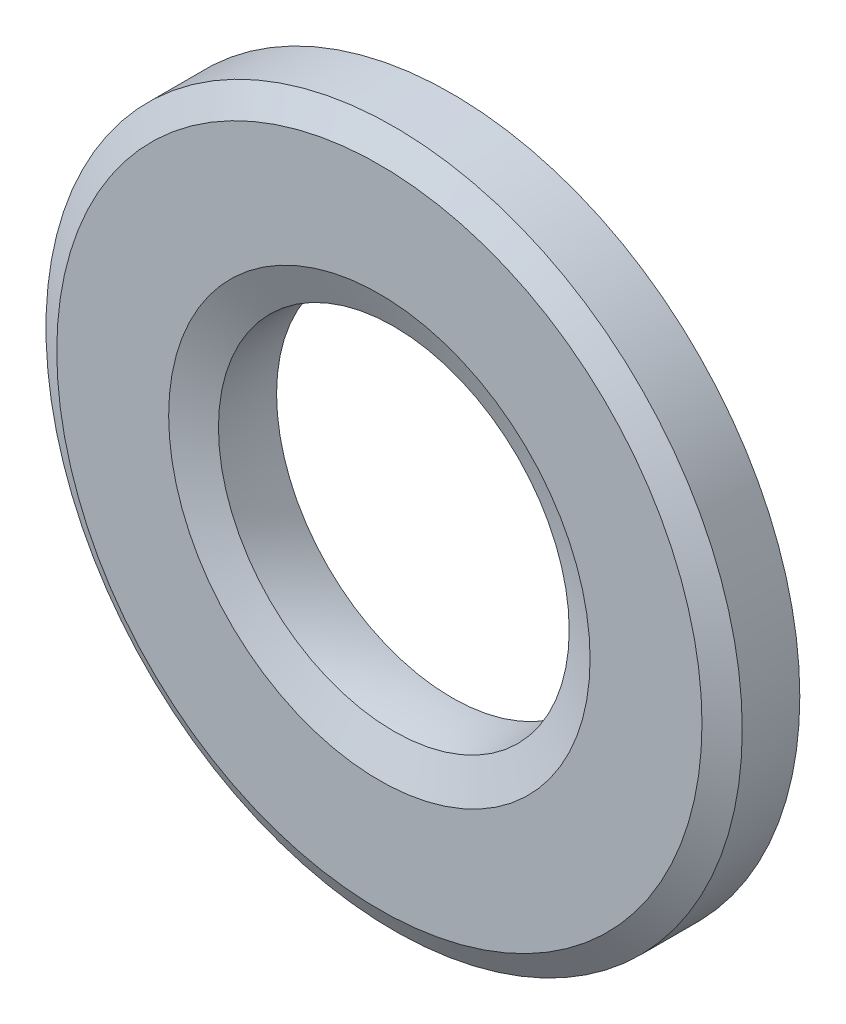
from build123d import *
from OCP.BRepFilletAPI import BRepFilletAPI_MakeChamfer

# Parameters (mm, degrees)
BOSS_EXTRUDE1_DEPTH      = 0.75
BOSS_EXTRUDE1_DEPTH_BACK = 0.75
SKETCH3_R                = 6
SKETCH3_R_2              = 3
CHAMFER1_SIZE            = 0.254
CHAMFER1_SIZE2           = 0.439940905
CHAMFER2_SIZE            = 0.580931391


with BuildPart() as part:
    # Sketch3 → Boss-Extrude1 (new, two sides: drawn at the far end of the back side and taken through both)
    with BuildSketch(Plane.XY.offset(-BOSS_EXTRUDE1_DEPTH_BACK)):
        Circle(SKETCH3_R)
        Circle(SKETCH3_R_2, mode=Mode.SUBTRACT)
    extrude(amount=BOSS_EXTRUDE1_DEPTH + BOSS_EXTRUDE1_DEPTH_BACK)

    # Chamfer1: one chamfer whose edges measure the first distance from different faces: ONE call of the kernel's chamfer builder (chamfer() names one face for all edges)
    chamfer1_edges_1 = [part.edges().sort_by_distance(p)[0] for p in [
        (-6, 0, 0.75),
    ]]
    chamfer1_side_1 = [part.faces().sort_by_distance(p)[0] for p in [
        (-6, 0, 0.375),
    ]]
    chamfer1_edges_2 = [part.edges().sort_by_distance(p)[0] for p in [
        (-6, 0, -0.75),
    ]]
    chamfer1_side_2 = [part.faces().sort_by_distance(p)[0] for p in [
        (-6, 0, -0.375),
    ]]
    chamfer1 = BRepFilletAPI_MakeChamfer(part.part.solid().wrapped)
    for e in chamfer1_edges_1:
        chamfer1.Add(CHAMFER1_SIZE, CHAMFER1_SIZE2, e.wrapped, chamfer1_side_1[0].wrapped)  # the first distance lies on this face
    for e in chamfer1_edges_2:
        chamfer1.Add(CHAMFER1_SIZE, CHAMFER1_SIZE2, e.wrapped, chamfer1_side_2[0].wrapped)  # the first distance lies on this face
    add(Compound.cast(chamfer1.Shape()), mode=Mode.REPLACE)

    # Sketch4 → Cut-Revolve1 (revolve, cut)
    with BuildSketch(Plane(origin=(0, 0, 0), x_dir=(0, 0, -1), z_dir=(1, 0, 0)), mode=Mode.PRIVATE) as cut_revolve1_sk:
        with BuildLine():
            Line((-0.75, 2.9492), (-0.75, 3.0508))
            ThreePointArc((-0.75, 3.0508), (0, 3), (0.75, 3.0508))
            Line((0.75, 3.0508), (0.75, 2.9492))
            Line((0.75, 2.9492), (-0.75, 2.9492))
        make_face()
    revolve(cut_revolve1_sk.sketch.rotate(Axis((0, 0, 0.75), (0, 0, -1)), 90), axis=Axis((0, 0, 0.75), (0, 0, -1)), mode=Mode.SUBTRACT)

    # Chamfer2
    # the kernel refuses this chamfer: 0.580931391, 0.254 mm, written as the material it takes off along each edge
    with BuildSketch(Plane(origin=(0, 0, -0.75), x_dir=(1, 0, 0), z_dir=(0, 1, 0))) as chamfer2_piece_1:
        with BuildLine():
            Line((3.0508 + CHAMFER2_SIZE, 0), (3.022591838, -0.249207666))
            ThreePointArc((3.022591838, -0.249207666), (3.034667103, -0.129981949), (3.0508, 0))
            Line((3.0508, 0), (3.0508 + CHAMFER2_SIZE, 0))
        make_face()
    revolve(axis=Axis((0, 0, -0.75), (0, 0, -1)), mode=Mode.SUBTRACT)
    with BuildSketch(Plane(origin=(0, 0, 0.75), x_dir=(1, 0, 0), z_dir=(0, 1, 0))) as chamfer2_piece_2:
        with BuildLine():
            Line((3.0508 + CHAMFER2_SIZE, 0), (3.022591838, 0.249207666))
            ThreePointArc((3.022591838, 0.249207666), (3.034667103, 0.129981949), (3.0508, 0))
            Line((3.0508, 0), (3.0508 + CHAMFER2_SIZE, 0))
        make_face()
    revolve(axis=Axis((0, 0, 0.75), (0, 0, -1)), mode=Mode.SUBTRACT)


solid = part.part
